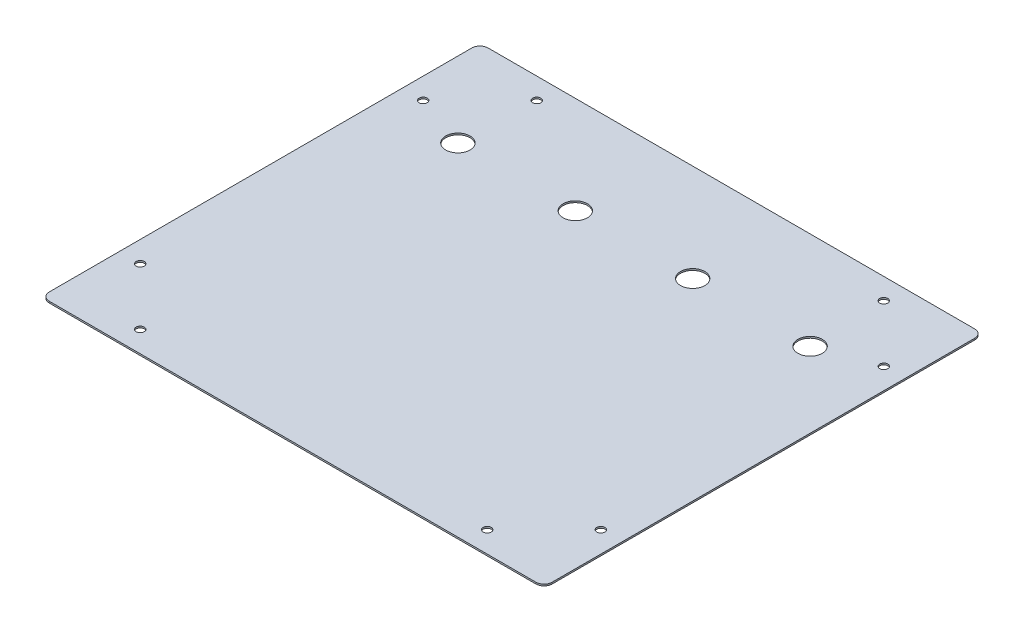
from build123d import *

# Parameters (mm, degrees)
SKETCH1_W          = 309.8
SKETCH1_H          = 270.34
BASE_FLANGE1_DEPTH = 1
FILLET1_R          = 5
SKETCH2_R          = 2.5
CUT_EXTRUDE1_DEPTH = 10
SKETCH4_R          = 7.5
CUT_EXTRUDE2_DEPTH = 10


# Sheet-metal steps are written as plain solids
with BuildPart() as part:
    # Sketch1 → Base-Flange1 (new body)
    with BuildSketch(Plane(origin=(0, 0, 0), x_dir=(1, 0, 0), z_dir=(0, 1, 0))):
        Rectangle(SKETCH1_W, SKETCH1_H)
    extrude(amount=-BASE_FLANGE1_DEPTH)

    # Fillet1
    fillet1_edges = [part.edges().sort_by_distance(p)[0] for p in [
        (-154.9, -0.5, -135.17),
        (154.9, -0.5, -135.17),
        (154.9, -0.5, 135.17),
        (-154.9, -0.5, 135.17),
    ]]
    fillet(fillet1_edges, radius=FILLET1_R)

    # Sketch2 → Cut-Extrude1 (cut)
    with BuildSketch(Plane.XZ.offset(1)):
        with Locations(Location((-141.9, 87.169485818, 0), (0, 0, 270))):
            Circle(SKETCH2_R)
        with Locations(Location((-106.9, 122.169485818, 0), (0, 0, 270))):
            Circle(SKETCH2_R)
        with Locations(Location((141.9, 87.169485818, 0), (0, 0, 90))):
            Circle(SKETCH2_R)
        with Locations(Location((106.9, 122.169485818, 0), (0, 0, 90))):
            Circle(SKETCH2_R)
        with Locations(Location((141.9, -87.169485818, 0), (0, 0, 270))):
            Circle(SKETCH2_R)
        with Locations(Location((106.9, -122.169485818, 0), (0, 0, 270))):
            Circle(SKETCH2_R)
        with Locations(Location((-141.9, -87.169485818, 0), (0, 0, 90))):
            Circle(SKETCH2_R)
        with Locations(Location((-106.9, -122.169485818, 0), (0, 0, 90))):
            Circle(SKETCH2_R)
    extrude(amount=-CUT_EXTRUDE1_DEPTH, mode=Mode.SUBTRACT)

    # Sketch4 → Cut-Extrude2 (cut)
    with BuildSketch(Plane(origin=(0, -1, 0), x_dir=(-1, 0, 0), z_dir=(0, -1, 0))):
        with Locations(Location((108.5, 75.17, 0), (0, 0, 90))):
            Circle(SKETCH4_R)
        with Locations(Location((36.166666667, 75.17, 0), (0, 0, 90))):
            Circle(SKETCH4_R)
        with Locations(Location((-36.166666667, 75.17, 0), (0, 0, 90))):
            Circle(SKETCH4_R)
        with Locations(Location((-108.5, 75.17, 0), (0, 0, 90))):
            Circle(SKETCH4_R)
    extrude(amount=-CUT_EXTRUDE2_DEPTH, mode=Mode.SUBTRACT)


solid = part.part
